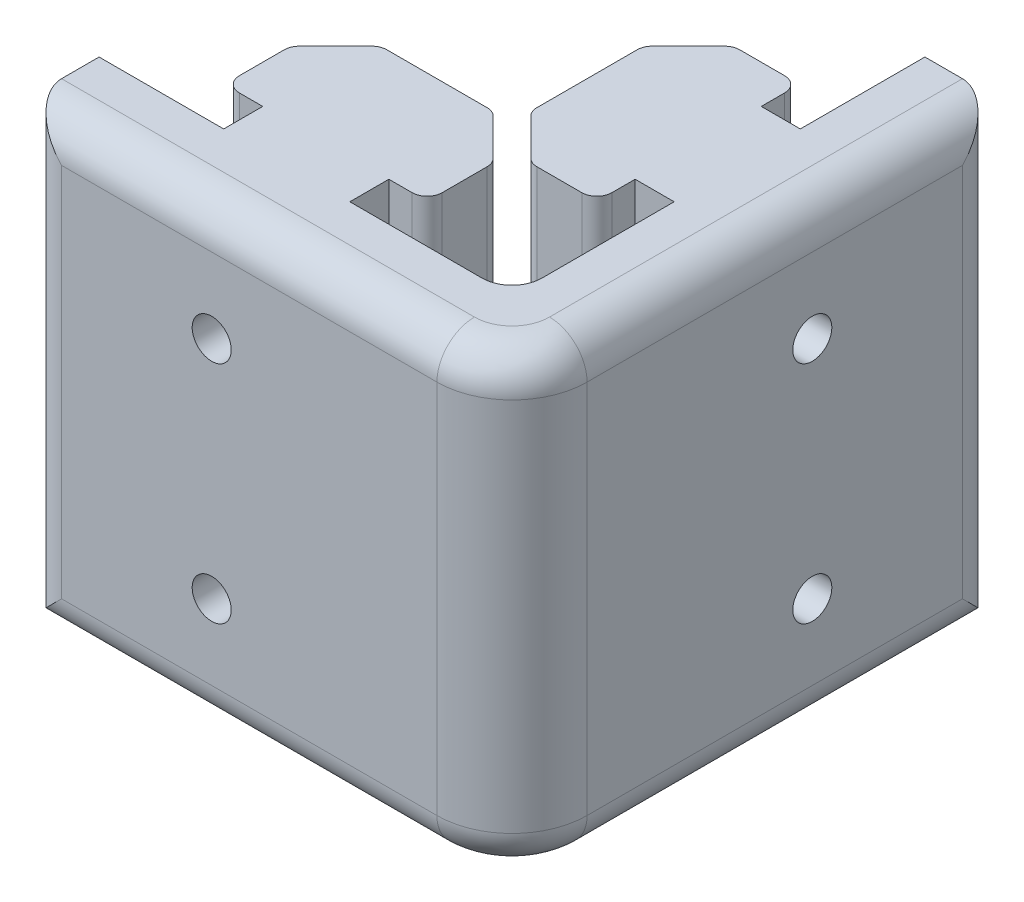
from build123d import *

# Parameters (mm, degrees)
BOSS_EXTRUDE1_DEPTH = 30
CUT_EXTRUDE1_REACH  = 52.249
SKETCH2_R           = 1.3
CUT_EXTRUDE2_REACH  = 52.249
SKETCH3_R           = 1.3
CUT_EXTRUDE3_REACH  = 52.249
SKETCH4_W           = 2.5
SKETCH4_H           = 30
CUT_EXTRUDE4_REACH  = 50.541
SKETCH5_W           = 2.5
SKETCH5_H           = 30
FILLET1_R           = 2.5
FILLET2_R           = 2
FILLET3_R           = 1


with BuildPart() as part:
    # Sketch1 → Boss-Extrude1 (new body)
    with BuildSketch(Plane(origin=(0, 0, 0), x_dir=(1, 0, 0), z_dir=(0, 1, 0))):
        with BuildLine():
            Line((20, -15), (20, 15))
            Line((20, 15), (15, 15))
            Line((15, 15), (15, 4.2))
            Line((15, 4.2), (12.4, 4.2))
            Line((12.4, 4.2), (12.4, 6.75))
            Line((12.4, 6.75), (8, 6.75))
            Line((8, 6.75), (5, 3.75))
            Line((5, 3.75), (5, -3.75))
            Line((5, -3.75), (8, -6.75))
            Line((8, -6.75), (12.4, -6.75))
            Line((12.4, -6.75), (12.4, -4.2))
            Line((12.4, -4.2), (15, -4.2))
            Line((15, -4.2), (15, -15))
            Line((15, -15), (4.2, -15))
            Line((4.2, -15), (4.2, -12.4))
            Line((4.2, -12.4), (6.75, -12.4))
            Line((6.75, -12.4), (6.75, -8))
            Line((6.75, -8), (3.75, -5))
            Line((3.75, -5), (-3.75, -5))
            Line((-3.75, -5), (-6.75, -8))
            Line((-6.75, -8), (-6.75, -12.4))
            Line((-6.75, -12.4), (-4.2, -12.4))
            Line((-4.2, -12.4), (-4.2, -15))
            Line((-4.2, -15), (-15, -15))
            Line((-15, -15), (-15, -20))
            Line((-15, -20), (15, -20))
            ThreePointArc((15, -20), (18.535533906, -18.535533906), (20, -15))
        make_face()
    extrude(amount=BOSS_EXTRUDE1_DEPTH)

    # Sketch2 → Cut-Extrude1 (cut, up to next)
    with BuildSketch(Plane.XY.offset(20), mode=Mode.PRIVATE) as cut_extrude1_sk1:
        with Locations((0, 22.5)):
            Circle(SKETCH2_R)
    cut_extrude1_tool1 = extrude(cut_extrude1_sk1.sketch, amount=-CUT_EXTRUDE1_REACH, mode=Mode.PRIVATE) & part.part
    # Sketch2 → Cut-Extrude1 (cut, up to next)
    with BuildSketch(Plane.XY.offset(20), mode=Mode.PRIVATE) as cut_extrude1_sk2:
        with Locations((0, 7.5)):
            Circle(SKETCH2_R)
    cut_extrude1_tool2 = extrude(cut_extrude1_sk2.sketch, amount=-CUT_EXTRUDE1_REACH, mode=Mode.PRIVATE) & part.part
    add(cut_extrude1_tool1.solids().sort_by_distance((0, 22.5, 20))[0], mode=Mode.SUBTRACT)
    add(cut_extrude1_tool2.solids().sort_by_distance((0, 7.5, 20))[0], mode=Mode.SUBTRACT)

    # Sketch3 → Cut-Extrude2 (cut, up to next)
    with BuildSketch(Plane(origin=(20, 0, 0), x_dir=(0, 0, -1), z_dir=(1, 0, 0)), mode=Mode.PRIVATE) as cut_extrude2_sk1:
        with Locations((0, 22.5)):
            Circle(SKETCH3_R)
    cut_extrude2_tool1 = extrude(cut_extrude2_sk1.sketch, amount=-CUT_EXTRUDE2_REACH, mode=Mode.PRIVATE) & part.part
    # Sketch3 → Cut-Extrude2 (cut, up to next)
    with BuildSketch(Plane(origin=(20, 0, 0), x_dir=(0, 0, -1), z_dir=(1, 0, 0)), mode=Mode.PRIVATE) as cut_extrude2_sk2:
        with Locations((0, 7.5)):
            Circle(SKETCH3_R)
    cut_extrude2_tool2 = extrude(cut_extrude2_sk2.sketch, amount=-CUT_EXTRUDE2_REACH, mode=Mode.PRIVATE) & part.part
    add(cut_extrude2_tool1.solids().sort_by_distance((20, 22.5, 0))[0], mode=Mode.SUBTRACT)
    add(cut_extrude2_tool2.solids().sort_by_distance((20, 7.5, 0))[0], mode=Mode.SUBTRACT)

    # Sketch4 → Cut-Extrude3 (cut, up to next)
    with BuildSketch(Plane.XY.offset(20), mode=Mode.PRIVATE) as cut_extrude3_sk1:
        with Locations((-13.75, 15)):
            Rectangle(SKETCH4_W, SKETCH4_H)
    cut_extrude3_tool1 = extrude(cut_extrude3_sk1.sketch, amount=-CUT_EXTRUDE3_REACH, mode=Mode.PRIVATE) & part.part
    add(cut_extrude3_tool1.solids().sort_by_distance((-13.75, 15, 20))[0], mode=Mode.SUBTRACT)

    # Sketch5 → Cut-Extrude4 (cut, up to next)
    with BuildSketch(Plane(origin=(20, 0, 0), x_dir=(0, 0, -1), z_dir=(1, 0, 0)), mode=Mode.PRIVATE) as cut_extrude4_sk1:
        with Locations((13.75, 15)):
            Rectangle(SKETCH5_W, SKETCH5_H)
    cut_extrude4_tool1 = extrude(cut_extrude4_sk1.sketch, amount=-CUT_EXTRUDE4_REACH, mode=Mode.PRIVATE) & part.part
    add(cut_extrude4_tool1.solids().sort_by_distance((20, 15, -13.75))[0], mode=Mode.SUBTRACT)

    # Fillet1
    fillet1_edges = [part.edges().sort_by_distance(p)[0] for p in [
        (1.25, 0, 20),
        (20, 0, 1.25),
        (1.25, 30, 20),
        (20, 30, 1.25),
        (18.535533906, 0, 18.535533906),
        (18.535533906, 30, 18.535533906),
        (20, 15, -12.5),
        (-12.5, 15, 20),
    ]]
    fillet(fillet1_edges, radius=FILLET1_R)

    # Fillet2
    fillet2_edges = [part.edges().sort_by_distance(p)[0] for p in [
        (15, 15, 15),
    ]]
    fillet(fillet2_edges, radius=FILLET2_R)

    # Fillet3
    fillet3_edges = [part.edges().sort_by_distance(p)[0] for p in [
        (12.4, 15, -6.75),
        (8, 15, -6.75),
        (5, 15, -3.75),
        (5, 15, 3.75),
        (8, 15, 6.75),
        (12.4, 15, 6.75),
        (6.75, 15, 12.4),
        (-6.75, 15, 12.4),
        (-3.75, 15, 5),
        (-6.75, 15, 8),
        (3.75, 15, 5),
        (6.75, 15, 8),
    ]]
    fillet(fillet3_edges, radius=FILLET3_R)


solid = part.part
